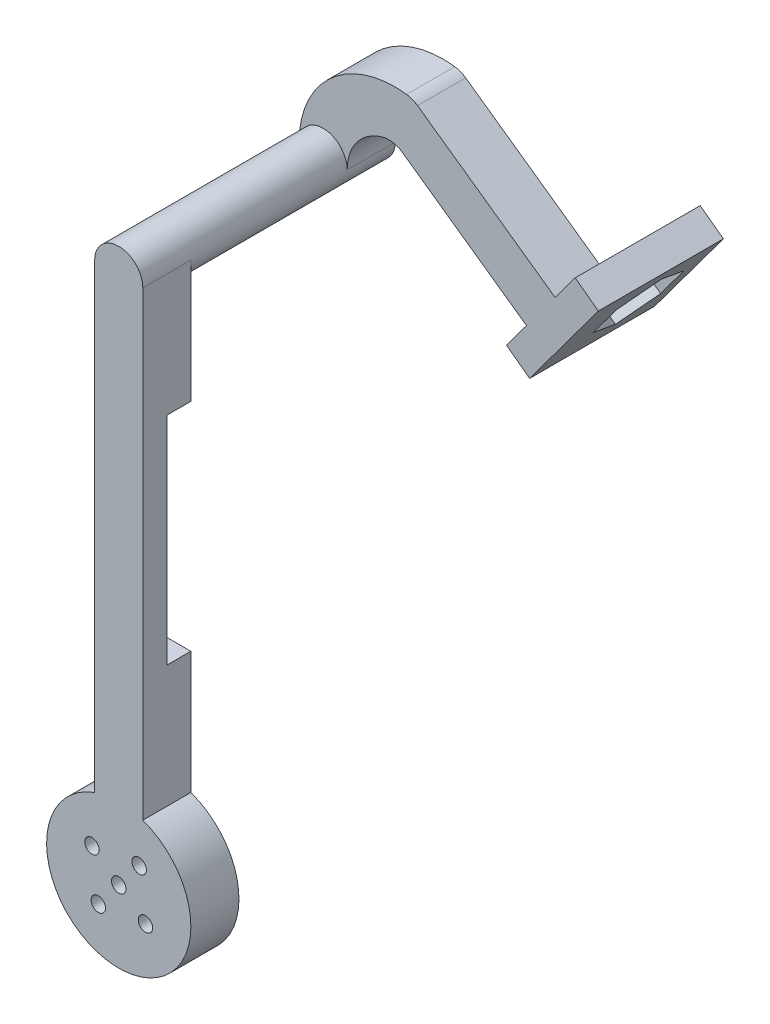
from build123d import *
from build123d.topology import SkipClean

# Parameters (mm, degrees)
BOSS_EXTRUDE1_DEPTH  = 10
SKETCH6_R            = 5
BOSS_EXTRUDE4_DEPTH  = 32.5
SKETCH10_W           = 10
SKETCH10_H           = 45
CUT_EXTRUDE5_DEPTH   = 10
CUT_EXTRUDE10_START  = -10
CUT_EXTRUDE10_DEPTH  = 10
BOSS_EXTRUDE8_DEPTH  = 10
SKETCH19_R           = 1.5
CUT_EXTRUDE11_DEPTH  = 110.357366333
BOSS_EXTRUDE9_DEPTH  = 16
BOSS_EXTRUDE10_DEPTH = 10
CUT_EXTRUDE12_DEPTH  = 6
SKETCH24_W           = 5
SKETCH24_H           = 45
CUT_EXTRUDE14_DEPTH  = 10


with BuildPart() as part:
    # Sketch1 → Boss-Extrude1 (new body)
    with BuildSketch(Plane.XY):
        with BuildLine():
            Line((-10, 0), (0, 0))
            Line((0, 0), (0, 70))
            ThreePointArc((0, 70), (2.048726408, 76.039631539), (7.349256082, 79.586293943))
            ThreePointArc((7.349256082, 79.586293943), (9.526416607, 79.679930085), (11.536628421, 78.838595348))
            Line((11.536628421, 78.838595348), (37.563736921, 60.412060989))
            ThreePointArc((37.563736921, 60.412060989), (44.533661589, 61.603761507), (43.341961071, 68.573686175))
            Line((43.341961071, 68.573686175), (14.637016156, 88.896060969))
            ThreePointArc((14.637016156, 88.896060969), (13.552177116, 89.478358799), (12.35793082, 89.777895591))
            ThreePointArc((12.35793082, 89.777895591), (11.217987252, 89.884880656), (10.073780788, 89.926217211))
            ThreePointArc((10.073780788, 89.926217211), (4.526251311, 89.180986887), (-0.595162082, 86.922319935))
            ThreePointArc((-0.595162082, 86.922319935), (-4.504675426, 83.740794413), (-7.490811299, 79.680081201))
            ThreePointArc((-7.490811299, 79.680081201), (-9.362505501, 75), (-10, 70))
            Line((-10, 70), (-10, 0))
        make_face()
    extrude(amount=BOSS_EXTRUDE1_DEPTH)

    # Sketch6 → Boss-Extrude4 (add)
    with BuildSketch(Plane.XY.offset(10)):
        with Locations((-5, 70)):
            Circle(SKETCH6_R)
    extrude(amount=BOSS_EXTRUDE4_DEPTH)

    # Sketch10 → Cut-Extrude5 (cut)
    with BuildSketch(Plane(origin=(0, 0, 0), x_dir=(-1, 0, 0), z_dir=(0, 0, -1))):
        with Locations((5, 22.5)):
            Rectangle(SKETCH10_W, SKETCH10_H)
    extrude(amount=-CUT_EXTRUDE5_DEPTH, mode=Mode.SUBTRACT)

    # Sketch17 → Cut-Extrude10 (cut)
    with BuildSketch(Plane.XY.offset(10).offset(CUT_EXTRUDE10_START)):
        with BuildLine():
            Line((-10, 45), (0, 45))
            Line((0, 45), (0, 70))
            ThreePointArc((0, 70), (-5, 65), (-10, 70))
            Line((-10, 70), (-10, 45))
        make_face()
    extrude(amount=CUT_EXTRUDE10_DEPTH, mode=Mode.SUBTRACT)

    # Sketch18 → Boss-Extrude8 (add)
    with SkipClean():  # the faces are left unmerged after this step: merging them gives an invalid solid
        with BuildSketch(Plane.XY.offset(42.5)):
            with BuildLine():
                Line((0, 70), (0, -25.857864376))
                ThreePointArc((0, -25.857864376), (-5, -55), (-10, -25.857864376))
                Line((-10, -25.857864376), (-10, 70))
                ThreePointArc((-10, 70), (-5, 75), (0, 70))
            make_face()
        extrude(amount=BOSS_EXTRUDE8_DEPTH)
    add(part.part.scale(1), mode=Mode.REPLACE)  # the faces are merged on a copy

    # Sketch19 → Cut-Extrude11 (cut, through all)
    with BuildSketch(Plane(origin=(0, 0, 42.5), x_dir=(-1, 0, 0), z_dir=(0, 0, -1))):
        with Locations((5, -40)):
            Circle(SKETCH19_R)
        with Locations((10.565661313, -35.754600825)):
            Circle(SKETCH19_R)
        with Locations((0.754600825, -34.434338687)):
            Circle(SKETCH19_R)
        with Locations((-0.565661313, -44.245399175)):
            Circle(SKETCH19_R)
        with Locations((9.245399175, -45.565661313)):
            Circle(SKETCH19_R)
    extrude(amount=-CUT_EXTRUDE11_DEPTH, mode=Mode.SUBTRACT)

    # Sketch20 → Boss-Extrude9 (add)
    with BuildSketch(Plane(origin=(0, 0, 0), x_dir=(-1, 0, 0), z_dir=(0, 0, -1))):
        Polygon((-52.228493699, 70.702095376), (-47.407985115, 74.274587083), (-33.118018288, 54.992552749), (-37.938526871, 51.420061042), align=None)
    extrude(amount=BOSS_EXTRUDE9_DEPTH)

    # Sketch21 → Boss-Extrude10 (add)
    with BuildSketch(Plane.XY):
        with BuildLine():
            Line((43.237723755, 68.647483557), (43.341961071, 68.573686175))
            ThreePointArc((43.341961071, 68.573686175), (44.533661589, 61.603761507), (37.563736921, 60.412060989))
            Line((37.563736921, 60.412060989), (37.282165609, 60.611406354))
            Line((37.282165609, 60.611406354), (33.118018288, 54.992552749))
            Line((33.118018288, 54.992552749), (37.938526871, 51.420061042))
            Line((37.938526871, 51.420061042), (52.228493699, 70.702095376))
            Line((52.228493699, 70.702095376), (47.407985115, 74.274587083))
            Line((47.407985115, 74.274587083), (43.237723755, 68.647483557))
        make_face()
    extrude(amount=BOSS_EXTRUDE10_DEPTH)

    # Sketch22 → Cut-Extrude12 (cut)
    with BuildSketch(Plane(origin=(-0.109097108, 0.080852156, 0), x_dir=(0, 0, -1), z_dir=(0.8034180972667123, -0.5954152844732287, 0))):
        Polygon((12.5, 71.859534489), (12.5, 79.942438258), (5.5, 83.983890142), (-1.5, 79.942438258), (-1.5, 71.859534489), (5.5, 67.818082605), align=None)
    extrude(amount=-CUT_EXTRUDE12_DEPTH, mode=Mode.SUBTRACT)

    # Sketch24 → Cut-Extrude14 (cut)
    with BuildSketch(Plane.ZY.offset(10)):
        with Locations((45, 22.071067812)):
            Rectangle(SKETCH24_W, SKETCH24_H)
    extrude(amount=-CUT_EXTRUDE14_DEPTH, mode=Mode.SUBTRACT)


solid = part.part
